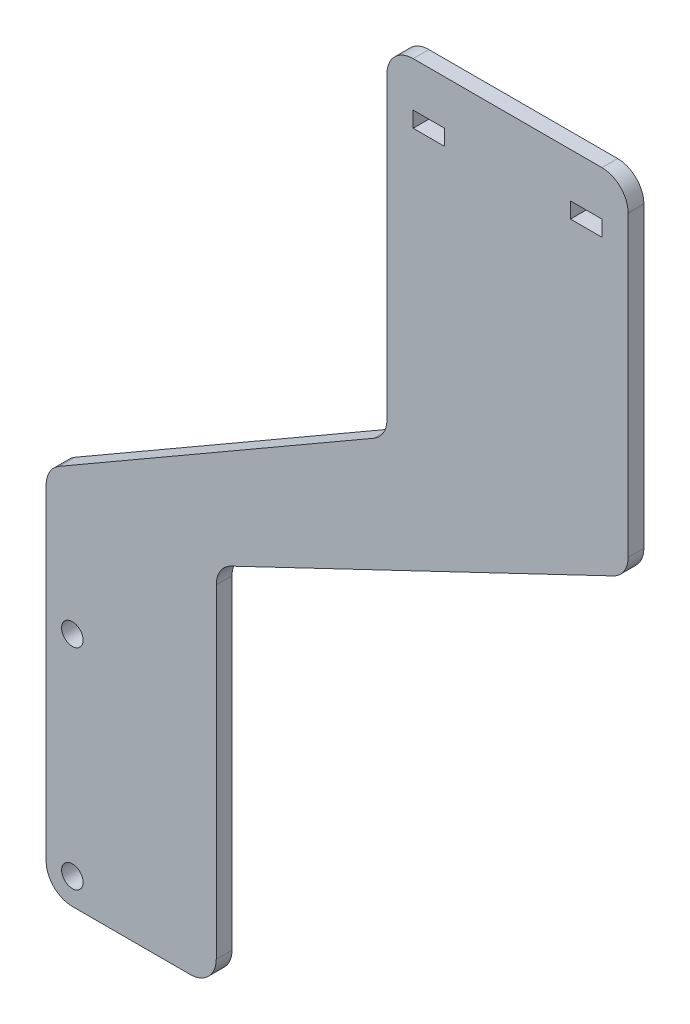
from build123d import *

# Parameters (mm, degrees)
SKETCH1_R           = 2.05
SKETCH1_W           = 6
SKETCH1_H           = 3
BOSS_EXTRUDE1_DEPTH = 3
FILLET1_R           = 5


with BuildPart() as part:
    # Sketch1 → Boss-Extrude1 (new body)
    with BuildSketch(Plane.XY):
        Polygon((-78.603832711, -5.527767497), (-111.052894204, -5.527767497), (-111.052894204, 64.472232503), (-46.052894204, 102), (-46.052894204, 167), (-0.052894204, 167), (-0.052894204, 102), (-78.603832711, 64.472232503), (-78.603832711, 45.043945933), align=None)
        with Locations((-106.052894204, 39.472232503)):
            Circle(SKETCH1_R, mode=Mode.SUBTRACT)
        with Locations((-106.052894204, -0.527767497)):
            Circle(SKETCH1_R, mode=Mode.SUBTRACT)
        with Locations((-38.052894204, 157)):
            Rectangle(SKETCH1_W, SKETCH1_H, mode=Mode.SUBTRACT)
        with Locations((-8.052894204, 157)):
            Rectangle(SKETCH1_W, SKETCH1_H, mode=Mode.SUBTRACT)
    extrude(amount=BOSS_EXTRUDE1_DEPTH)

    # Fillet1
    fillet1_edges = [part.edges().sort_by_distance(p)[0] for p in [
        (-46.052894204, 167, 1.5),
        (-0.052894204, 167, 1.5),
        (-111.052894204, -5.527767497, 1.5),
        (-46.052894204, 102, 1.5),
        (-111.052894204, 64.472232503, 1.5),
        (-78.603832711, -5.527767497, 1.5),
        (-78.603832711, 64.472232503, 1.5),
        (-0.052894204, 102, 1.5),
    ]]
    fillet(fillet1_edges, radius=FILLET1_R)


solid = part.part
